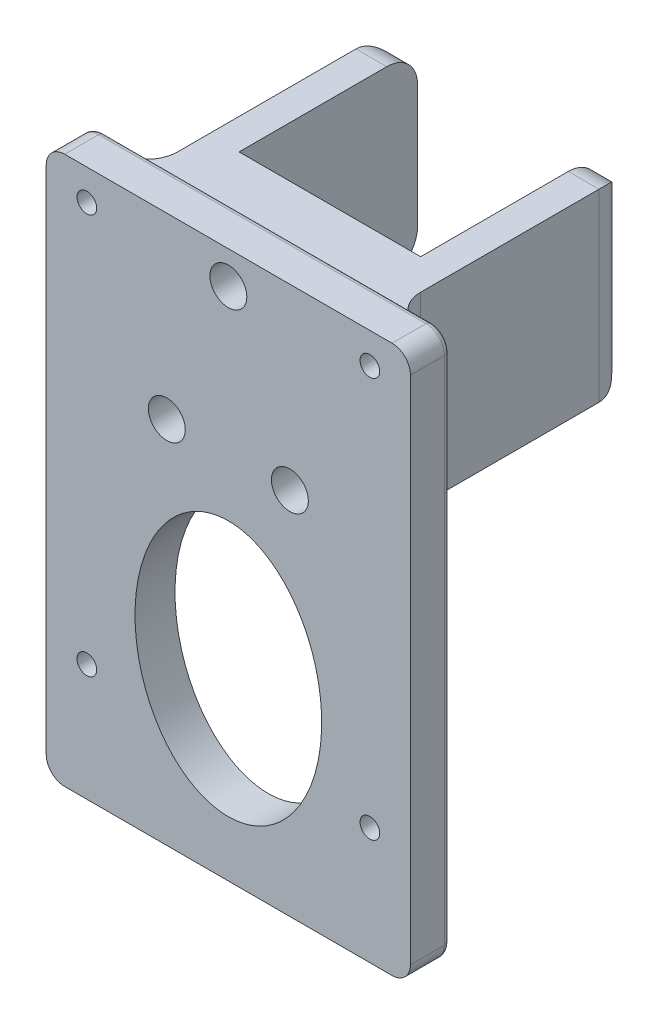
from build123d import *

# Parameters (mm, degrees)
SKETCH_1_W               = 59.2
SKETCH_1_H               = 89
SKETCH_1_R               = 1.6
EXTRUDE_1_DEPTH          = 6.5
SKETCH_2_W               = 29.5
SKETCH_2_H               = 30
EXTRUDE_2_DEPTH          = 10
SKETCH_3_W               = 5
SKETCH_3_H               = 30
EXTRUDE_3_DEPTH          = 39
SKETCH_4_R               = 2.75
CUT_EXTRUDE_1_DEPTH      = 3.2
CUT_EXTRUDE_2_DEPTH      = 100
CUT_EXTRUDE_2_DEPTH_BACK = 100
SKETCH_5_R               = 1.6
SKETCH_6_R               = 3
CUT_EXTRUDE_3_DEPTH      = 5.5
FILLET_1_R               = 3
FILLET_2_R               = 5
FILLET_5_R               = 1
FILLET_6_R               = 5
SKETCH_7_RX              = 20.824026905
SKETCH_7_RY              = 15.170998686
CUT_EXTRUDE_4_DEPTH      = 10


# Some blends are built 0.0001 mm under size
with BuildPart() as part:
    # 草图1 → 凸台-拉伸1 (new body)
    with BuildSketch(Plane.XY):
        with Locations((0, -7)):
            Rectangle(SKETCH_1_W, SKETCH_1_H)
        with Locations(Location((-23, -32.5, 0), (0, 0, 180))):
            Circle(SKETCH_1_R, mode=Mode.SUBTRACT)
        with Locations(Location((23, -32.5, 0), (0, 0, 180))):
            Circle(SKETCH_1_R, mode=Mode.SUBTRACT)
        with Locations(Location((23, 32.5, 0), (0, 0, 180))):
            Circle(SKETCH_1_R, mode=Mode.SUBTRACT)
        with Locations(Location((-23, 32.5, 0), (0, 0, 180))):
            Circle(SKETCH_1_R, mode=Mode.SUBTRACT)
    extrude(amount=EXTRUDE_1_DEPTH)

    # 草图2 → 凸台-拉伸2 (add)
    with BuildSketch(Plane(origin=(0, 0, 0), x_dir=(-1, 0, 0), z_dir=(0, 0, -1))):
        with Locations((0, 20.5)):
            Rectangle(SKETCH_2_W, SKETCH_2_H)
    extrude(amount=EXTRUDE_2_DEPTH)

    # 草图3 → 凸台-拉伸3 (add)
    with BuildSketch(Plane(origin=(0, 0, 0), x_dir=(-1, 0, 0), z_dir=(0, 0, -1))):
        with Locations((17.25, 20.5)):
            Rectangle(SKETCH_3_W, SKETCH_3_H)
        with Locations((-17.25, 20.5)):
            Rectangle(SKETCH_3_W, SKETCH_3_H)
    extrude(amount=EXTRUDE_3_DEPTH)

    # 草图4 → 切除-拉伸1 (cut)
    with BuildSketch(Plane(origin=(0, 0, 0), x_dir=(-1, 0, 0), z_dir=(0, 0, -1))):
        with Locations((23, -32.5)):
            Circle(SKETCH_4_R)
        with Locations((-23, -32.5)):
            Circle(SKETCH_4_R)
        with Locations((23, 32.5)):
            Circle(SKETCH_4_R)
        with Locations((-23, 32.5)):
            Circle(SKETCH_4_R)
    extrude(amount=-CUT_EXTRUDE_1_DEPTH, mode=Mode.SUBTRACT)

    # 草图5 → 切除-拉伸2 (cut, two sides: drawn at the far end of the back side and taken through both)
    with BuildSketch(Plane(origin=(0, 0, -10), x_dir=(-1, 0, 0), z_dir=(0, 0, -1)).offset(-CUT_EXTRUDE_2_DEPTH_BACK)):
        with Locations(Location((0, 32.2, 0), (0, 0, 180))):
            Circle(SKETCH_5_R)
        with Locations(Location((10, 8.5, 0), (0, 0, 180))):
            Circle(SKETCH_5_R)
        with Locations(Location((-10, 8.5, 0), (0, 0, 180))):
            Circle(SKETCH_5_R)
    extrude(amount=CUT_EXTRUDE_2_DEPTH + CUT_EXTRUDE_2_DEPTH_BACK, mode=Mode.SUBTRACT)

    # 草图6 → 切除-拉伸3 (cut)
    with BuildSketch(Plane.XY.offset(6.5)):
        with Locations((10, 8.5)):
            Circle(SKETCH_6_R)
        with Locations((-10, 8.5)):
            Circle(SKETCH_6_R)
        with Locations((0, 32.2)):
            Circle(SKETCH_6_R)
    extrude(amount=-CUT_EXTRUDE_3_DEPTH, mode=Mode.SUBTRACT)

    # 圆角1
    fillet_1_edges = [part.edges().sort_by_distance(p)[0] for p in [
        (29.6, -51.5, 3.25),
        (-29.6, -51.5, 3.25),
        (-29.6, 37.5, 3.25),
        (29.6, 37.5, 3.25),
    ]]
    fillet(fillet_1_edges, radius=FILLET_1_R)

    # 圆角2
    # the kernel refuses this fillet: 5 mm, written as the material it adds along each edge
    with BuildSketch(Plane(origin=(-19.75, 5.5, 0), x_dir=(0, -1, 0), z_dir=(1, 0, 0))) as fillet_2_piece_1:
        with BuildLine():
            CenterArc((FILLET_2_R, FILLET_2_R), FILLET_2_R, 180, 90)
            Line((0, FILLET_2_R), (0, 0))
            Line((0, 0), (FILLET_2_R, 0))
        make_face()
    extrude(amount=39.5)
    with BuildSketch(Plane(origin=(-19.75, 35.5, 0), x_dir=(-1, 0, 0), z_dir=(0, -1, 0))) as fillet_2_piece_2_section:
        with BuildLine():
            CenterArc((FILLET_2_R, FILLET_2_R), FILLET_2_R, 180, 90)
            Line((0, FILLET_2_R), (0, 0))
            Line((0, 0), (FILLET_2_R, 0))
        make_face()
    fillet_2_piece_2 = extrude(amount=30, mode=Mode.PRIVATE)
    fillet_2_piece_2 = fillet_2_piece_2 - Plane(origin=(-23, 32.5, -1.1830281), x_dir=(-1, 0, 0), z_dir=(0, 0, -1)) * Cylinder(2.75, 80, mode=Mode.PRIVATE)
    add(fillet_2_piece_2)
    with BuildSketch(Plane(origin=(19.75, 35.5, 0), x_dir=(1, 0, 0), z_dir=(0, -1, 0))) as fillet_2_piece_3_section:
        with BuildLine():
            CenterArc((FILLET_2_R, -FILLET_2_R), FILLET_2_R, 90, 90)
            Line((0, -FILLET_2_R), (0, 0))
            Line((0, 0), (FILLET_2_R, 0))
        make_face()
    fillet_2_piece_3 = extrude(amount=30, mode=Mode.PRIVATE)
    fillet_2_piece_3 = fillet_2_piece_3 - Plane(origin=(23, 32.5, -1.183032565), x_dir=(-1, 0, 0), z_dir=(0, 0, -1)) * Cylinder(2.75, 80, mode=Mode.PRIVATE)
    add(fillet_2_piece_3)
    with BuildSketch(Plane(origin=(-32.25, 5.5, 0), x_dir=(0, -1, 0), z_dir=(1, 0, 0))) as fillet_2_piece_4a_section:
        with BuildLine():
            CenterArc((FILLET_2_R, FILLET_2_R), FILLET_2_R, 180, 90)
            Line((0, FILLET_2_R), (0, 0))
            Line((0, 0), (FILLET_2_R, 0))
        make_face()
    fillet_2_piece_4a = extrude(amount=52, mode=Mode.PRIVATE)
    fillet_2_piece_4a = split(fillet_2_piece_4a, bisect_by=Plane(origin=(-29.6, 4.368024429, -1.131975571), z_dir=(1, 0, 0)), keep=Keep.TOP, mode=Mode.PRIVATE)
    fillet_2_piece_4a = split(fillet_2_piece_4a, bisect_by=Plane(origin=(-19.75, 4.368024429, -1.131975571), z_dir=(-1, 0, 0)), keep=Keep.TOP, mode=Mode.PRIVATE)
    with BuildSketch(Plane(origin=(-19.75, 35.5, 0), x_dir=(-1, 0, 0), z_dir=(0, -1, 0))) as fillet_2_piece_4b_section:
        with BuildLine():
            CenterArc((FILLET_2_R, FILLET_2_R), FILLET_2_R, 180, 90)
            Line((0, FILLET_2_R), (0, 0))
            Line((0, 0), (FILLET_2_R, 0))
        make_face()
    fillet_2_piece_4b = extrude(amount=42.5, mode=Mode.PRIVATE)
    fillet_2_piece_4b = split(fillet_2_piece_4b, bisect_by=Plane(origin=(-20.881975571, 5.5, -1.131975571), z_dir=(0, -1, 0)), keep=Keep.TOP, mode=Mode.PRIVATE)
    fillet_2_piece_4 = fillet_2_piece_4a & fillet_2_piece_4b
    add(fillet_2_piece_4)
    with BuildSketch(Plane(origin=(-19.75, 5.5, 0), x_dir=(0, -1, 0), z_dir=(1, 0, 0))) as fillet_2_piece_5a_section:
        with BuildLine():
            CenterArc((FILLET_2_R, FILLET_2_R), FILLET_2_R, 180, 90)
            Line((0, FILLET_2_R), (0, 0))
            Line((0, 0), (FILLET_2_R, 0))
        make_face()
    fillet_2_piece_5a = extrude(amount=52, mode=Mode.PRIVATE)
    fillet_2_piece_5a = split(fillet_2_piece_5a, bisect_by=Plane(origin=(29.6, 4.368024429, -1.131975571), z_dir=(-1, 0, 0)), keep=Keep.TOP, mode=Mode.PRIVATE)
    fillet_2_piece_5a = split(fillet_2_piece_5a, bisect_by=Plane(origin=(19.75, 4.368024429, -1.131975571), z_dir=(1, 0, 0)), keep=Keep.TOP, mode=Mode.PRIVATE)
    with BuildSketch(Plane(origin=(19.75, 35.5, 0), x_dir=(1, 0, 0), z_dir=(0, -1, 0))) as fillet_2_piece_5b_section:
        with BuildLine():
            CenterArc((FILLET_2_R, -FILLET_2_R), FILLET_2_R, 90, 90)
            Line((0, -FILLET_2_R), (0, 0))
            Line((0, 0), (FILLET_2_R, 0))
        make_face()
    fillet_2_piece_5b = extrude(amount=42.5, mode=Mode.PRIVATE)
    fillet_2_piece_5b = split(fillet_2_piece_5b, bisect_by=Plane(origin=(20.881975571, 5.5, -1.131975571), z_dir=(0, -1, 0)), keep=Keep.TOP, mode=Mode.PRIVATE)
    fillet_2_piece_5 = fillet_2_piece_5a & fillet_2_piece_5b
    add(fillet_2_piece_5)

    # 圆角5
    fillet_5_edges = [part.edges().sort_by_distance(p)[0] for p in [
        (-29.6, -7, 0),
        (29.6, -7, 0),
        (0, -51.5, 0),
        (0, 37.5, 0),
        (-28.721320344, -50.621320344, 0),
        (28.721320344, -50.621320344, 0),
        (28.721320344, 36.621320344, 0),
        (-28.721320344, 36.621320344, 0),
    ]]
    fillet(fillet_5_edges, radius=FILLET_5_R)

    # 圆角6
    fillet_6_edges = [part.edges().sort_by_distance(p)[0] for p in [
        (-17.25, 5.5, -39),
        (-19.75, 20.5, -39),
        (-17.25, 35.5, -39),
        (17.25, 35.5, -39),
        (19.75, 20.5, -39),
        (17.25, 5.5, -39),
    ]]
    fillet(fillet_6_edges, radius=FILLET_6_R - 0.0001)  # a hair under: the kernel refuses the full size

    # 草图7 → 切除-拉伸4 (cut)
    with BuildSketch(Plane.XY.offset(6.5)):
        with Locations(Location((0, -21.62670202), (0, 0, -90))):
            Ellipse(SKETCH_7_RX, SKETCH_7_RY)
    extrude(amount=-CUT_EXTRUDE_4_DEPTH, mode=Mode.SUBTRACT)


solid = part.part
